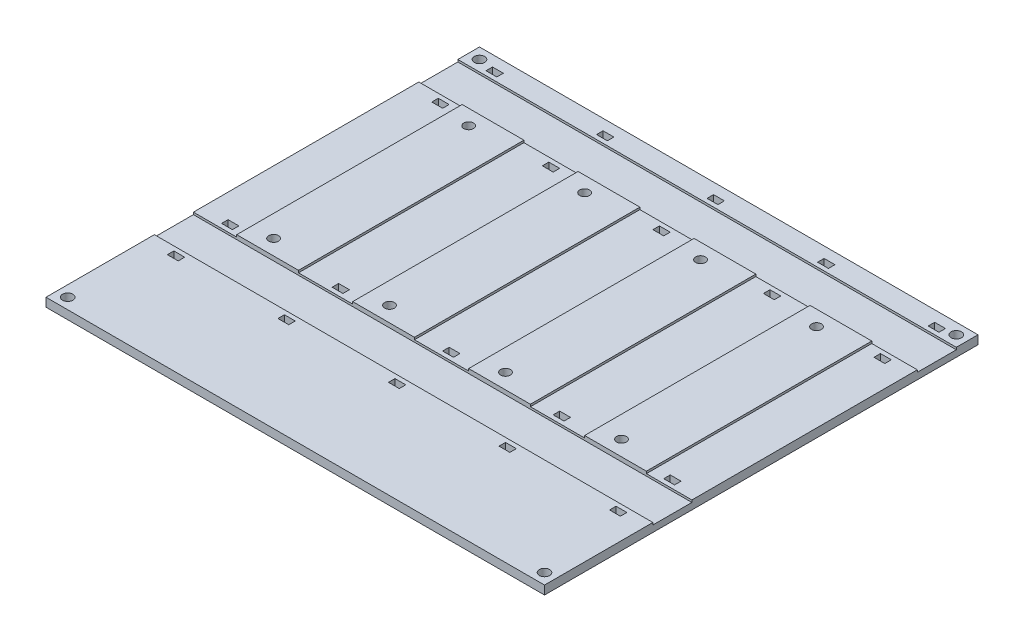
from build123d import *

# Parameters (mm, degrees)
BODY_SKETCH_W                          = 230
BODY_SKETCH_H                          = 200
BODY_DEPTH                             = 4
MOUNTING_HOLES_OUTLINE_R               = 2.4
MOUNTING_HOLES_DEPTH                   = 4
SKETCH4_W                              = 230
SKETCH4_H                              = 18
CABLE_CUTOUTS_DEPTH                    = 1
SKETCH6_W                              = 28.5
SKETCH6_H                              = 104
DRIVER_EXTRUSION_DEPTH                 = 1
DRIVER_MOUNTING_HOLES_OUTLINE_R        = 2.25
DRIVER_MOUNTING_HOLES_DEPTH            = 5
DRIVER_PATTERN_COUNT                   = 4
DRIVER_PATTERN_PITCH                   = 53.5
SKETCH9_W                              = 5
SKETCH9_H                              = 3
CABLE_FIXIATOR_CUTOUT_DEPTH            = 153.449991801
CABLE_FIXIATOR_PATTERN_COUNT           = 5
CABLE_FIXIATOR_PATTERN_PITCH           = 51
CABLE_FIXIATOR_PATTERN_COPY_1_SKETCH_W = 5
CABLE_FIXIATOR_PATTERN_COPY_1_SKETCH_H = 3
CABLE_FIXIATOR_PATTERN_COPY_1_DEPTH    = 153.449991801
CABLE_FIXIATOR_PATTERN_COPY_2_SKETCH_W = 5
CABLE_FIXIATOR_PATTERN_COPY_2_SKETCH_H = 3
CABLE_FIXIATOR_PATTERN_COPY_2_DEPTH    = 153.449991801
CABLE_FIXIATOR_PATTERN_COPY_3_SKETCH_W = 5
CABLE_FIXIATOR_PATTERN_COPY_3_SKETCH_H = 3
CABLE_FIXIATOR_PATTERN_COPY_3_DEPTH    = 153.449991801
CABLE_FIXIATOR_PATTERN_COPY_4_SKETCH_W = 5
CABLE_FIXIATOR_PATTERN_COPY_4_SKETCH_H = 3
CABLE_FIXIATOR_PATTERN_COPY_4_DEPTH    = 153.449991801


# Read off the part's stored shape, not the designer's step: mounting_holes, driver_mounting_holes
with BuildPart() as part:
    # body_sketch → body (new body)
    with BuildSketch(Plane(origin=(0, 0, 0), x_dir=(1, 0, 0), z_dir=(0, 1, 0))):
        Rectangle(BODY_SKETCH_W, BODY_SKETCH_H)
    extrude(amount=BODY_DEPTH)

    # mounting_holes outline → mounting_holes (cut)
    with BuildSketch(Plane(origin=(0, 0, 0), x_dir=(1, 0, 0), z_dir=(0, 1, 0))):
        with Locations((110, -95)):
            Circle(MOUNTING_HOLES_OUTLINE_R)
        with Locations((-110, 95)):
            Circle(MOUNTING_HOLES_OUTLINE_R)
        with Locations((-110, -95)):
            Circle(MOUNTING_HOLES_OUTLINE_R)
        with Locations((110, 95)):
            Circle(MOUNTING_HOLES_OUTLINE_R)
    extrude(amount=MOUNTING_HOLES_DEPTH, mode=Mode.SUBTRACT)

    # Sketch4 → cable_cutouts (cut)
    with BuildSketch(Plane(origin=(0, 4, 0), x_dir=(1, 0, 0), z_dir=(0, 1, 0))):
        with Locations((0, 81)):
            Rectangle(SKETCH4_W, SKETCH4_H)
        with Locations((0, -41)):
            Rectangle(SKETCH4_W, SKETCH4_H)
    extrude(amount=-CABLE_CUTOUTS_DEPTH, mode=Mode.SUBTRACT)

    # Sketch6 → driver_extrusion (add)
    with BuildSketch(Plane(origin=(0, 4, 0), x_dir=(1, 0, 0), z_dir=(0, 1, 0))):
        with Locations((-80.75, 20)):
            Rectangle(SKETCH6_W, SKETCH6_H)
    driver_extrusion = extrude(amount=DRIVER_EXTRUSION_DEPTH)

    # driver_mounting_holes outline → driver_mounting_holes (cut)
    with BuildSketch(Plane(origin=(0, 0, 0), x_dir=(1, 0, 0), z_dir=(0, 1, 0))):
        with Locations((-85, -25)):
            Circle(DRIVER_MOUNTING_HOLES_OUTLINE_R)
        with Locations((-85, 65)):
            Circle(DRIVER_MOUNTING_HOLES_OUTLINE_R)
    driver_mounting_holes = extrude(amount=DRIVER_MOUNTING_HOLES_DEPTH, mode=Mode.SUBTRACT)

    # driver_pattern: driver_extrusion, driver_mounting_holes ×4
    with Locations(*[(i * DRIVER_PATTERN_PITCH, 0, 0) for i in range(1, DRIVER_PATTERN_COUNT)]):
        add(driver_extrusion)
        add(driver_mounting_holes, mode=Mode.SUBTRACT)

    # Sketch9 → cable_fixiator_cutout (cut, through all)
    with BuildSketch(Plane(origin=(0, 4, 0), x_dir=(1, 0, 0), z_dir=(0, 1, 0))):
        with Locations((-101.5, 93.5)):
            Rectangle(SKETCH9_W, SKETCH9_H)
        with Locations((-101.5, 68.5)):
            Rectangle(SKETCH9_W, SKETCH9_H)
    cable_fixiator_cutout = extrude(amount=-CABLE_FIXIATOR_CUTOUT_DEPTH, mode=Mode.SUBTRACT)

    # cable_fixiator_mirror: cable_fixiator_cutout across plane
    add(cable_fixiator_cutout.mirror(Plane.XY.offset(-20)), mode=Mode.SUBTRACT)

    # cable_fixiator_pattern: cable_fixiator_cutout ×5
    with Locations(*[(i * CABLE_FIXIATOR_PATTERN_PITCH, 0, 0) for i in range(1, CABLE_FIXIATOR_PATTERN_COUNT)]):
        add(cable_fixiator_cutout, mode=Mode.SUBTRACT)

    # cable_fixiator_pattern copy 1 sketch → cable_fixiator_pattern copy 1 (cut, through all)
    with BuildSketch(Plane(origin=(51, 4, -40), x_dir=(1, 0, 0), z_dir=(0, 1, 0))):
        with Locations((-101.5, -93.5)):
            Rectangle(CABLE_FIXIATOR_PATTERN_COPY_1_SKETCH_W, CABLE_FIXIATOR_PATTERN_COPY_1_SKETCH_H)
        with Locations((-101.5, -68.5)):
            Rectangle(CABLE_FIXIATOR_PATTERN_COPY_1_SKETCH_W, CABLE_FIXIATOR_PATTERN_COPY_1_SKETCH_H)
    extrude(amount=-CABLE_FIXIATOR_PATTERN_COPY_1_DEPTH, mode=Mode.SUBTRACT)

    # cable_fixiator_pattern copy 2 sketch → cable_fixiator_pattern copy 2 (cut, through all)
    with BuildSketch(Plane(origin=(102, 4, -40), x_dir=(1, 0, 0), z_dir=(0, 1, 0))):
        with Locations((-101.5, -93.5)):
            Rectangle(CABLE_FIXIATOR_PATTERN_COPY_2_SKETCH_W, CABLE_FIXIATOR_PATTERN_COPY_2_SKETCH_H)
        with Locations((-101.5, -68.5)):
            Rectangle(CABLE_FIXIATOR_PATTERN_COPY_2_SKETCH_W, CABLE_FIXIATOR_PATTERN_COPY_2_SKETCH_H)
    extrude(amount=-CABLE_FIXIATOR_PATTERN_COPY_2_DEPTH, mode=Mode.SUBTRACT)

    # cable_fixiator_pattern copy 3 sketch → cable_fixiator_pattern copy 3 (cut, through all)
    with BuildSketch(Plane(origin=(153, 4, -40), x_dir=(1, 0, 0), z_dir=(0, 1, 0))):
        with Locations((-101.5, -93.5)):
            Rectangle(CABLE_FIXIATOR_PATTERN_COPY_3_SKETCH_W, CABLE_FIXIATOR_PATTERN_COPY_3_SKETCH_H)
        with Locations((-101.5, -68.5)):
            Rectangle(CABLE_FIXIATOR_PATTERN_COPY_3_SKETCH_W, CABLE_FIXIATOR_PATTERN_COPY_3_SKETCH_H)
    extrude(amount=-CABLE_FIXIATOR_PATTERN_COPY_3_DEPTH, mode=Mode.SUBTRACT)

    # cable_fixiator_pattern copy 4 sketch → cable_fixiator_pattern copy 4 (cut, through all)
    with BuildSketch(Plane(origin=(204, 4, -40), x_dir=(1, 0, 0), z_dir=(0, 1, 0))):
        with Locations((-101.5, -93.5)):
            Rectangle(CABLE_FIXIATOR_PATTERN_COPY_4_SKETCH_W, CABLE_FIXIATOR_PATTERN_COPY_4_SKETCH_H)
        with Locations((-101.5, -68.5)):
            Rectangle(CABLE_FIXIATOR_PATTERN_COPY_4_SKETCH_W, CABLE_FIXIATOR_PATTERN_COPY_4_SKETCH_H)
    extrude(amount=-CABLE_FIXIATOR_PATTERN_COPY_4_DEPTH, mode=Mode.SUBTRACT)


solid = part.part
